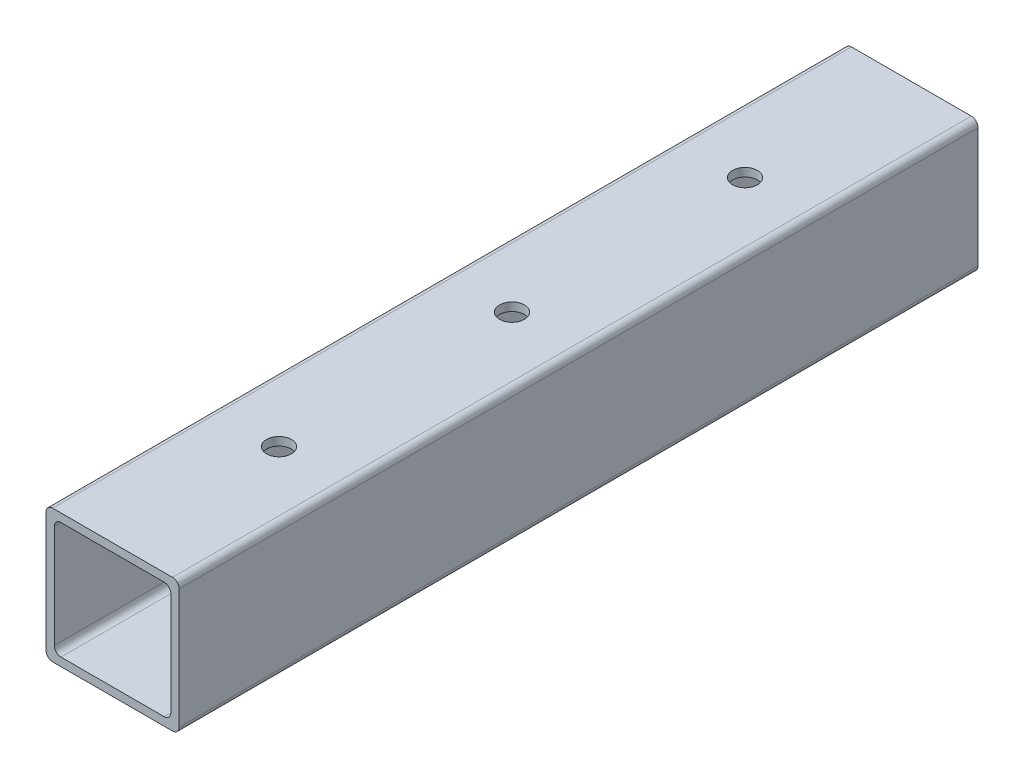
from build123d import *

# Parameters (mm, degrees)
BOSS_EXTRUDE1_DEPTH = 152.4
SKETCH2_R           = 4.7625
CUT_EXTRUDE1_DEPTH  = 76.2


with BuildPart() as part:
    # Sketch1 → Boss-Extrude1 (new, symmetric)
    with BuildSketch(Plane.XY):
        with BuildLine():
            Line((-22.86, -25.4), (22.86, -25.4))
            ThreePointArc((22.86, -25.4), (24.656051224, -24.656051224), (25.4, -22.86))
            Line((25.4, -22.86), (25.4, 22.86))
            ThreePointArc((25.4, 22.86), (24.656051224, 24.656051224), (22.86, 25.4))
            Line((22.86, 25.4), (-22.86, 25.4))
            ThreePointArc((-22.86, 25.4), (-24.656051224, 24.656051224), (-25.4, 22.86))
            Line((-25.4, 22.86), (-25.4, -22.86))
            ThreePointArc((-25.4, -22.86), (-24.656051224, -24.656051224), (-22.86, -25.4))
        make_face()
        with BuildLine():
            Line((-19.685, 22.225), (19.685, 22.225))
            ThreePointArc((19.685, 22.225), (21.481051224, 21.481051224), (22.225, 19.685))
            Line((22.225, 19.685), (22.225, -19.685))
            ThreePointArc((22.225, -19.685), (21.481051224, -21.481051224), (19.685, -22.225))
            Line((19.685, -22.225), (-19.685, -22.225))
            ThreePointArc((-19.685, -22.225), (-21.481051224, -21.481051224), (-22.225, -19.685))
            Line((-22.225, -19.685), (-22.225, 19.685))
            ThreePointArc((-22.225, 19.685), (-21.481051224, 21.481051224), (-19.685, 22.225))
        make_face(mode=Mode.SUBTRACT)
    extrude(amount=BOSS_EXTRUDE1_DEPTH, both=True)

    # Sketch2 → Cut-Extrude1 (cut, symmetric)
    with BuildSketch(Plane(origin=(0, 0, 0), x_dir=(1, 0, 0), z_dir=(0, 1, 0))):
        Circle(SKETCH2_R)
        with Locations((0, 88.9)):
            Circle(SKETCH2_R)
        with Locations((0, -88.9)):
            Circle(SKETCH2_R)
    extrude(amount=CUT_EXTRUDE1_DEPTH, both=True, mode=Mode.SUBTRACT)


solid = part.part
